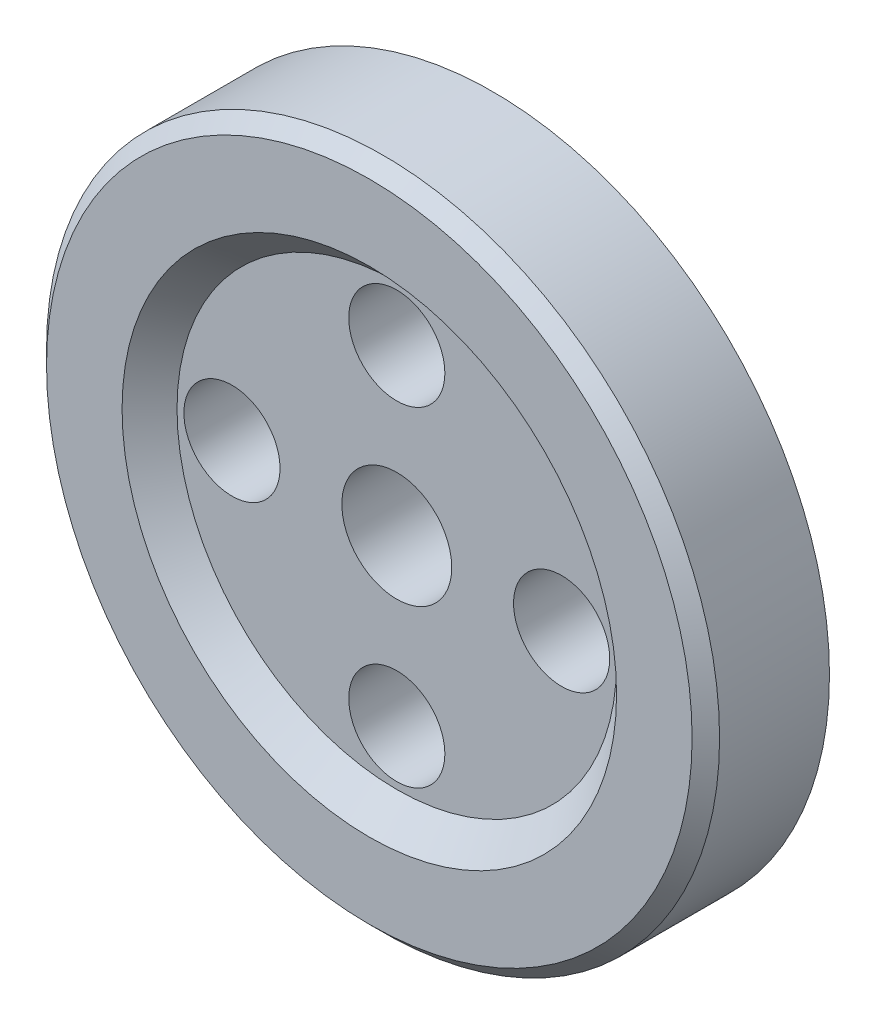
from build123d import *

# Parameters (mm, degrees)
SKETCH1_R           = 24.5
SKETCH1_R_2         = 3.5
SKETCH1_R_3         = 4
BOSS_EXTRUDE1_DEPTH = 4.5
SKETCH2_R           = 16
CUT_EXTRUDE1_DEPTH  = 2
CHAMFER1_SIZE       = 2
CHAMFER2_SIZE       = 1


with BuildPart() as part:
    # Sketch1 → Boss-Extrude1 (new, symmetric)
    with BuildSketch(Plane.XY):
        Circle(SKETCH1_R)
        with Locations((0, 12)):
            Circle(SKETCH1_R_2, mode=Mode.SUBTRACT)
        with Locations((-12, 0)):
            Circle(SKETCH1_R_2, mode=Mode.SUBTRACT)
        with Locations((0, -12)):
            Circle(SKETCH1_R_2, mode=Mode.SUBTRACT)
        with Locations((12, 0)):
            Circle(SKETCH1_R_2, mode=Mode.SUBTRACT)
        Circle(SKETCH1_R_3, mode=Mode.SUBTRACT)
    extrude(amount=BOSS_EXTRUDE1_DEPTH, both=True)

    # Sketch2 → Cut-Extrude1 (cut)
    with BuildSketch(Plane.XY.offset(4.5)):
        Circle(SKETCH2_R)
    extrude(amount=-CUT_EXTRUDE1_DEPTH, mode=Mode.SUBTRACT)

    # Chamfer1
    chamfer1_edges = [part.edges().sort_by_distance(p)[0] for p in [
        (-16, 0, 4.5),
    ]]
    chamfer(chamfer1_edges, length=CHAMFER1_SIZE - 0.0001)  # a hair under: the kernel refuses the full size

    # Chamfer2
    chamfer2_edges = [part.edges().sort_by_distance(p)[0] for p in [
        (-24.5, 0, 4.5),
    ]]
    chamfer(chamfer2_edges, length=CHAMFER2_SIZE)


solid = part.part
